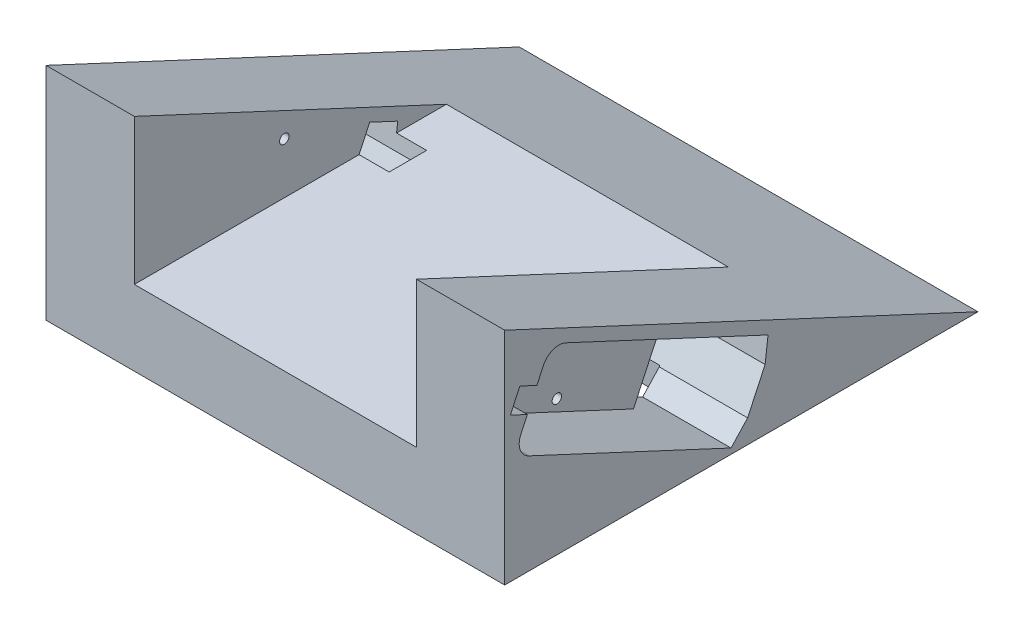
from build123d import *

# Parameters (mm, degrees)
SKETCH1_W           = 85
SKETCH1_H           = 80
BOSS_EXTRUDE1_DEPTH = 5
SKETCH4_W           = 5
SKETCH4_H           = 80
BOSS_EXTRUDE3_DEPTH = 30
SKETCH6_R           = 1.25
CUT_EXTRUDE3_DEPTH  = 101.249688279
SKETCH3_W           = 85
SKETCH3_H           = 80
BOSS_EXTRUDE4_DEPTH = 15
SKETCH8_W           = 8
SKETCH8_H           = 12
CUT_EXTRUDE4_DEPTH  = 69.053287944
MOVE_FACE1_BY       = 3
BOSS_EXTRUDE5_DEPTH = 18.5
BOSS_EXTRUDE6_START = -103.5
BOSS_EXTRUDE6_DEPTH = 18.5
CUT_EXTRUDE5_START  = -13
CUT_EXTRUDE5_DEPTH  = 13
CUT_EXTRUDE6_START  = -85
CUT_EXTRUDE6_DEPTH  = 13
DELETEFACE1_START   = 37.5
DELETEFACE1_DEPTH   = 23.5
DELETEFACE2_START   = -61
DELETEFACE2_DEPTH   = 23.5
DELETEFACE3_START   = -61
DELETEFACE3_DEPTH   = 122


# Read off the part's stored shape, not the designer's step: DeleteFace1, DeleteFace2, DeleteFace3
with BuildPart() as part:
    # Sketch1 → Boss-Extrude1 (new body)
    with BuildSketch(Plane(origin=(0, 0, 0), x_dir=(1, 0, 0), z_dir=(0, 1, 0))):
        Rectangle(SKETCH1_W, SKETCH1_H)
    extrude(amount=BOSS_EXTRUDE1_DEPTH)

    # Sketch4 → Boss-Extrude3 (add)
    with BuildSketch(Plane(origin=(0, 5, 0), x_dir=(1, 0, 0), z_dir=(0, 1, 0))):
        with Locations((-40, 0)):
            Rectangle(SKETCH4_W, SKETCH4_H)
        with Locations((40, 0)):
            Rectangle(SKETCH4_W, SKETCH4_H)
    extrude(amount=BOSS_EXTRUDE3_DEPTH)

    # Sketch6 → Cut-Extrude3 (cut, through all)
    with BuildSketch(Plane.ZY.offset(42.5)):
        with Locations((10.624581332, 2.504153155)):
            Circle(SKETCH6_R)
        with Locations((3.123107186, 18.591116375)):
            Circle(SKETCH6_R)
        Polygon((24.335207615, 35), (-40, 5), (-40, 35), align=None)
    extrude(amount=-CUT_EXTRUDE3_DEPTH, mode=Mode.SUBTRACT)

    # Sketch3 → Boss-Extrude4 (add)
    with BuildSketch(Plane.XZ):
        Rectangle(SKETCH3_W, SKETCH3_H)
        Polygon((29.5, -21.75), (37.5, -21.75), (37.5, -9.75), (29.5, -9.75), (29.5, 31.75), (-29.5, 31.75), (-29.5, -31.75), (29.5, -31.75), align=None, mode=Mode.SUBTRACT)
    extrude(amount=BOSS_EXTRUDE4_DEPTH)

    # Sketch8 → Cut-Extrude4 (cut, through all)
    with BuildSketch(Plane.XZ):
        with Locations((33.5, -15.75)):
            Rectangle(SKETCH8_W, SKETCH8_H)
    extrude(amount=-CUT_EXTRUDE4_DEPTH, mode=Mode.SUBTRACT)

    # Move Face1: a face moved outward by 3.0
    extrude(part.faces().sort_by_distance((0, -1.25, 40))[0], amount=MOVE_FACE1_BY, dir=(0, 0, 1))

    # Sketch7 → Boss-Extrude5 (add)
    with BuildSketch(Plane(origin=(42.5, 0, 0), x_dir=(0, 0, -1), z_dir=(1, 0, 0))):
        Polygon((40, -15), (40, 5), (-24.335207615, 35), (-43, 35), (-43, -15), align=None)
        with BuildLine():
            Line((-26.692544096, 32.64359903), (27.051507675, 7.582336108))
            Line((27.051507675, 7.582336108), (26.26502094, 1.163306695))
            Line((26.26502094, 1.163306695), (21.61622006, -8.806078963))
            Line((21.61622006, -8.806078963), (17.204502177, -13.534635329))
            Line((17.204502177, -13.534635329), (-36.539549595, 11.526627592))
            ThreePointArc((-36.539549595, 11.526627592), (-38.86638421, 14.065921988), (-38.716152458, 17.506794811))
            Line((-38.716152458, 17.506794811), (-36.962286672, 21.267972127))
            Line((-36.962286672, 21.267972127), (-41.493825607, 23.381063436))
            Line((-41.493825607, 23.381063436), (-38.958116037, 28.818910158))
            Line((-38.958116037, 28.818910158), (-34.426577102, 26.70581885))
            Line((-34.426577102, 26.70581885), (-32.672711316, 30.466996166))
            ThreePointArc((-32.672711316, 30.466996166), (-30.133416919, 32.793830782), (-26.692544096, 32.64359903))
        make_face(mode=Mode.SUBTRACT)
    extrude(amount=BOSS_EXTRUDE5_DEPTH)

    # Sketch7<2> → Boss-Extrude6 (add)
    with BuildSketch(Plane(origin=(42.5, 0, 0), x_dir=(0, 0, -1), z_dir=(1, 0, 0)).offset(BOSS_EXTRUDE6_START)):
        Polygon((40, -15), (40, 5), (-24.335207615, 35), (-43, 35), (-43, -15), align=None)
        with BuildLine():
            Line((-26.692544096, 32.64359903), (27.051507675, 7.582336108))
            Line((27.051507675, 7.582336108), (26.26502094, 1.163306695))
            Line((26.26502094, 1.163306695), (21.61622006, -8.806078963))
            Line((21.61622006, -8.806078963), (17.204502177, -13.534635329))
            Line((17.204502177, -13.534635329), (-36.539549595, 11.526627592))
            ThreePointArc((-36.539549595, 11.526627592), (-38.86638421, 14.065921988), (-38.716152458, 17.506794811))
            Line((-38.716152458, 17.506794811), (-36.962286672, 21.267972127))
            Line((-36.962286672, 21.267972127), (-41.493825607, 23.381063436))
            Line((-41.493825607, 23.381063436), (-38.958116037, 28.818910158))
            Line((-38.958116037, 28.818910158), (-34.426577102, 26.70581885))
            Line((-34.426577102, 26.70581885), (-32.672711316, 30.466996166))
            ThreePointArc((-32.672711316, 30.466996166), (-30.133416919, 32.793830782), (-26.692544096, 32.64359903))
        make_face(mode=Mode.SUBTRACT)
    extrude(amount=BOSS_EXTRUDE6_DEPTH)

    # Sketch9 → Cut-Extrude5 (cut)
    with BuildSketch(Plane(origin=(42.5, 0, 0), x_dir=(0, 0, -1), z_dir=(1, 0, 0)).offset(CUT_EXTRUDE5_START)):
        Polygon((21.61622006, -8.806078963), (26.26502094, 1.163306695), (27.051507675, 7.582336108), (19.597005499, 11.058427561), (9.75, -10.058543877), (17.204502177, -13.534635329), align=None)
    extrude(amount=CUT_EXTRUDE5_DEPTH, mode=Mode.SUBTRACT)

    # Sketch9<3> → Cut-Extrude6 (cut)
    with BuildSketch(Plane(origin=(42.5, 0, 0), x_dir=(0, 0, -1), z_dir=(1, 0, 0)).offset(CUT_EXTRUDE6_START)):
        Polygon((21.61622006, -8.806078963), (26.26502094, 1.163306695), (27.051507675, 7.582336108), (19.597005499, 11.058427561), (9.75, -10.058543877), (17.204502177, -13.534635329), align=None)
    extrude(amount=CUT_EXTRUDE6_DEPTH, mode=Mode.SUBTRACT)

    # DeleteFace1 outline → DeleteFace1 (add)
    with BuildSketch(Plane.YZ.offset(DELETEFACE1_START)):
        Polygon((43.703535627, 43), (35, 43), (35, 24.335207615), align=None)
    extrude(amount=DELETEFACE1_DEPTH)

    # DeleteFace2 outline → DeleteFace2 (add)
    with BuildSketch(Plane.YZ.offset(DELETEFACE2_START)):
        Polygon((43.703535627, 43), (35, 43), (35, 24.335207615), align=None)
    extrude(amount=DELETEFACE2_DEPTH)

    # DeleteFace3 outline → DeleteFace3 (add)
    with BuildSketch(Plane.YZ.offset(DELETEFACE3_START)):
        Polygon((-15, -82.89013841), (5, -40), (-15, -40), align=None)
    extrude(amount=DELETEFACE3_DEPTH)


solid = part.part
